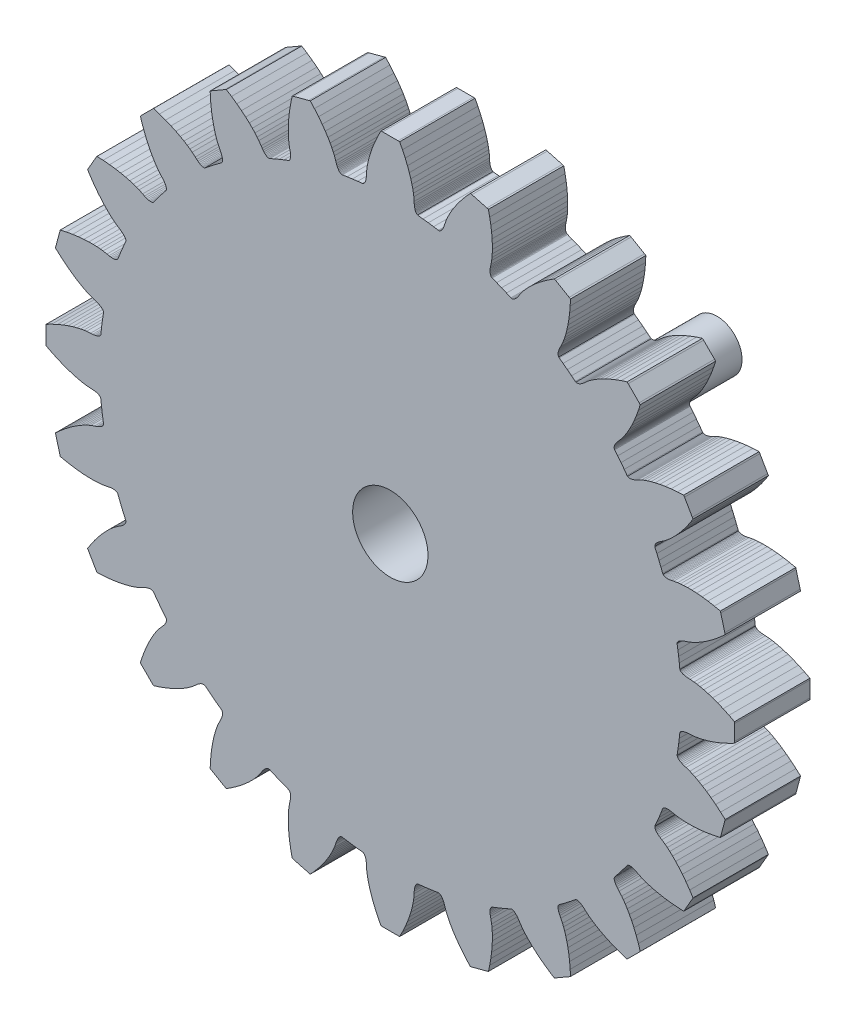
from build123d import *

# Parameters (mm, degrees)
SKETCH2_R           = 1.905
BOSS_EXTRUDE1_DEPTH = 3.81
SKETCH3_R           = 3.81
BOSS_EXTRUDE2_DEPTH = 2.54
SKETCH4_R           = 1.27
BOSS_EXTRUDE3_DEPTH = 10.16


with BuildPart() as part:
    # Sketch2 → Boss-Extrude1 (new body)
    with BuildSketch(Plane.XY):
        Polygon((3.289576242, 23.003571315), (3.038944057, 22.794199304), (2.802065264, 22.611666434), (2.578939862, 22.45437037), (2.372505468, 22.321776998), (2.181960915, 22.210281061), (2.010911459, 22.11908139), (1.861760607, 22.048044458), (1.731437212, 21.992229725), (1.541560299, 21.924130411), (1.439277799, 21.892217202), (1.369843203, 21.866179229), (1.308286764, 21.838672447), (1.25460848, 21.809696856), (1.20827424, 21.779920097), (1.169818157, 21.749475697), (1.138706117, 21.718363657), (1.115472233, 21.687919258), (1.100383561, 21.657474858), (1.092371877, 21.627030458), (1.093039517, 21.59164552), (1.130694433, 21.352630278), (1.168349348, 21.085173557), (1.201063725, 20.817983892), (1.226434058, 20.577366313), (1.235113382, 20.541981375), (1.250335582, 20.515142233), (1.273569466, 20.489638372), (1.304013865, 20.466538016), (1.341668781, 20.444772941), (1.386534212, 20.425277843), (1.439277799, 20.408586835), (1.498831317, 20.394165803), (1.565461823, 20.38401767), (1.638768733, 20.376673626), (1.745858244, 20.372400728), (1.947352099, 20.355843248), (2.087155986, 20.335413453), (2.249926702, 20.304969054), (2.439135974, 20.261572432), (2.651445603, 20.20295361), (2.885386779, 20.127510251), (3.14176067, 20.034040603), (3.417763187, 19.91880588), (3.713394331, 19.78127197), (3.991533297, 19.637862824), (3.993803274, 19.559615376), (3.993803274, 18.774203278), (3.991533297, 18.695421718), (3.713394331, 18.552546685), (3.417763187, 18.415012774), (3.14176067, 18.299778051), (2.885386779, 18.205640763), (2.651445603, 18.130998573), (2.439135974, 18.072246223), (2.249926702, 18.028849601), (2.087155986, 17.998405201), (1.947352099, 17.978108935), (1.745858244, 17.961551454), (1.638768733, 17.957145028), (1.565461823, 17.949800984), (1.498831317, 17.939118739), (1.439277799, 17.92523182), (1.386534212, 17.908540811), (1.341668781, 17.889045713), (1.304013865, 17.867280638), (1.273569466, 17.843379114), (1.250335582, 17.818008781), (1.235113382, 17.791303167), (1.226434058, 17.756452341), (1.201063725, 17.51596829), (1.168349348, 17.247843929), (1.130694433, 16.981321904), (1.093039517, 16.742306662), (1.092371877, 16.705987028), (1.100383561, 16.676343796), (1.115472233, 16.645899397), (1.138706117, 16.615454997), (1.169818157, 16.584342957), (1.20827424, 16.553898558), (1.25460848, 16.524255327), (1.308286764, 16.495279736), (1.369843203, 16.467639426), (1.439277799, 16.441601452), (1.541560299, 16.409688244), (1.731437212, 16.341588929), (1.861760607, 16.285907725), (2.010911459, 16.214203152), (2.181960915, 16.123537593), (2.372505468, 16.012041656), (2.578939862, 15.878780644), (2.802065264, 15.72148458), (3.038944057, 15.539619351), (3.289576242, 15.329579699), (3.520713328, 15.119540048), (3.501752342, 15.043429049), (3.299056735, 14.284188452), (3.276624019, 14.208878621), (2.971512383, 14.142915756), (2.649976794, 14.086433383), (2.353678011, 14.046642018), (2.081147223, 14.021939326), (1.836390274, 14.010455912), (1.615534849, 14.008987103), (1.422052678, 14.015529978), (1.256878457, 14.028482201), (1.116273401, 14.04517321), (0.917850692, 14.081359316), (0.812630574, 14.1045932), (0.740391889, 14.116877782), (0.673093742, 14.123420658), (0.612071415, 14.125557107), (0.557191379, 14.122619489), (0.508587162, 14.116210142), (0.466392293, 14.1045932), (0.431007355, 14.089371), (0.402031764, 14.071211183), (0.38013316, 14.048778467), (0.36290804, 14.017666428), (0.275981267, 13.791603408), (0.175301104, 13.541638864), (0.070348042, 13.293944297), (-0.028329201, 13.072287704), (-0.038343806, 13.038238046), (-0.038343806, 13.006992478), (-0.03113329, 12.973743989), (-0.016712259, 12.937557883), (0.005052816, 12.899902967), (0.033894879, 12.860779243), (0.070882154, 12.820186711), (0.115881113, 12.778125369), (0.168090588, 12.735396387), (0.228178219, 12.692654052), (0.318576721, 12.635423922), (0.48455211, 12.520242611), (0.595513935, 12.432568081), (0.721430903, 12.325358395), (0.863504768, 12.192791729), (1.018530855, 12.035589134), (1.183571548, 11.85375061), (1.358226261, 11.644391952), (1.54009149, 11.406778754), (1.727030786, 11.139468914), (1.896477905, 10.876485384), (1.858822989, 10.807665017), (1.466250468, 10.128140677), (1.425657936, 10.060775767), (1.112801671, 10.075263562), (0.788194937, 10.104239153), (0.491094985, 10.142641826), (0.222436512, 10.189723823), (-0.017379899, 10.241158834), (-0.231024808, 10.296946861), (-0.416495295, 10.354176992), (-0.572990191, 10.409230614), (-0.704114755, 10.461386678), (-0.886781152, 10.547605751), (-0.981586081, 10.597585307), (-1.049151283, 10.628016354), (-1.111909475, 10.651917878), (-1.170795353, 10.669303233), (-1.224340109, 10.680893469), (-1.272944326, 10.686688587), (-1.316340948, 10.686688587), (-1.354797032, 10.681614521), (-1.38737788, 10.671466388), (-1.414083494, 10.655536489), (-1.438786187, 10.629458457), (-1.580860051, 10.433866543), (-1.743096654, 10.218699413), (-1.908938515, 10.006443196), (-2.061828153, 9.818088503), (-2.079854443, 9.787657456), (-2.088533767, 9.757226409), (-2.090002576, 9.723190105), (-2.08559615, 9.684787432), (-2.074112736, 9.642779502), (-2.055952918, 9.597139608), (-2.030716114, 9.548588802), (-1.998802905, 9.496446092), (-1.959011541, 9.442100168), (-1.911876133, 9.384870038), (-1.839370392, 9.305914891), (-1.708913469, 9.151609855), (-1.624256673, 9.038591698), (-1.530787026, 8.90168537), (-1.427970413, 8.737218848), (-1.318610925, 8.545979948), (-1.206180291, 8.327194208), (-1.091746737, 8.07944623), (-0.977313182, 7.80343036), (-0.865683717, 7.496983443), (-0.770878789, 7.198534858), (-0.825224713, 7.142025779), (-1.380167365, 6.587109833), (-1.436516209, 6.532763909), (-1.73508497, 6.627662307), (-2.041531887, 6.739238361), (-2.317400876, 6.853698621), (-2.565228971, 6.968158882), (-2.784081475, 7.080455987), (-2.975293669, 7.189828828), (-3.139800249, 7.292712204), (-3.276666519, 7.386155147), (-3.389764793, 7.470905412), (-3.543989712, 7.601308923), (-3.623038329, 7.673761253), (-3.680188342, 7.720856603), (-3.734534266, 7.760688026), (-3.786610212, 7.792561176), (-3.835214429, 7.817918156), (-3.880881029, 7.836037915), (-3.92294237, 7.847628151), (-3.961264926, 7.851967813), (-3.995314583, 7.85052571), (-4.025625455, 7.84181968), (-4.056069854, 7.823726627), (-4.244477959, 7.670850341), (-4.456921115, 7.504955069), (-4.672034834, 7.34269176), (-4.867386398, 7.200698013), (-4.893557899, 7.176075437), (-4.909581267, 7.149263001), (-4.9197294, 7.116668799), (-4.924803467, 7.078266127), (-4.924803467, 7.034816093), (-4.91906176, 6.986265288), (-4.90731129, 6.932667121), (-4.890086169, 6.873981535), (-4.866184645, 6.810942934), (-4.835740245, 6.743578023), (-4.78566722, 6.648679625), (-4.699408088, 6.466133403), (-4.647332141, 6.334995487), (-4.592185049, 6.178527297), (-4.534901507, 5.993070162), (-4.479353831, 5.779345136), (-4.427678468, 5.539582137), (-4.380676588, 5.270790135), (-4.342220505, 4.973783653), (-4.313378442, 4.649243683), (-4.298823883, 4.336280596), (-4.366122029, 4.295701416), (-5.045646369, 3.903062131), (-5.114413324, 3.865393863), (-5.377463619, 4.034921099), (-5.64492034, 4.221820336), (-5.882466773, 4.403658859), (-6.091838784, 4.578246809), (-6.273570485, 4.743421029), (-6.43086655, 4.898433764), (-6.563459922, 5.040440864), (-6.670682961, 5.166478008), (-6.758410901, 5.277319658), (-6.873512096, 5.44321493), (-6.93066211, 5.533773666), (-6.97352462, 5.593901355), (-7.016120073, 5.646070771), (-7.058181415, 5.690976261), (-7.098907476, 5.727923477), (-7.1380312, 5.756899068), (-7.175686115, 5.778624085), (-7.211738694, 5.79311188), (-7.245120711, 5.800362454), (-7.276366279, 5.800362454), (-7.310282408, 5.790214321), (-7.532072529, 5.691710665), (-7.779900624, 5.586664134), (-8.029598112, 5.485957264), (-8.255661132, 5.399017139), (-8.2869067, 5.381645137), (-8.309339415, 5.359906768), (-8.327499233, 5.33094453), (-8.342721432, 5.295439417), (-8.354204846, 5.253418133), (-8.360747722, 5.204880681), (-8.363685339, 5.149827058), (-8.361415362, 5.088978317), (-8.355006015, 5.021600054), (-8.342721432, 4.949161077), (-8.319487549, 4.844114546), (-8.283167914, 4.645611719), (-8.266610433, 4.505073427), (-8.253524683, 4.339899207), (-8.246981807, 4.146470447), (-8.248450616, 3.925521552), (-8.25993403, 3.68065778), (-8.284636723, 3.408287227), (-8.324561615, 3.11197509), (-8.381043988, 2.790319326), (-8.446873326, 2.485341218), (-8.522183156, 2.462881797), (-9.281423753, 2.260052661), (-9.357534752, 2.241211851), (-9.567574403, 2.472308879), (-9.777747583, 2.722967769), (-9.959479284, 2.959846562), (-10.116775348, 3.182971964), (-10.250169889, 3.389446416), (-10.361532298, 3.579977617), (-10.452331384, 3.750933603), (-10.523902429, 3.900164572), (-10.579717161, 4.030554731), (-10.647682948, 4.220378233), (-10.679596157, 4.322527205), (-10.705767658, 4.392068623), (-10.73327444, 4.453638415), (-10.762383559, 4.507249935), (-10.79202679, 4.553624233), (-10.82247119, 4.592013552), (-10.85358323, 4.623165651), (-10.884027629, 4.646346123), (-10.914472029, 4.66155497), (-10.94411526, 4.669526596), (-10.980301367, 4.668792192), (-11.219316609, 4.631123924), (-11.485972161, 4.593455656), (-11.753962995, 4.560848101), (-11.994580574, 4.535504474), (-12.0294314, 4.526798444), (-12.056137013, 4.511589597), (-12.081507346, 4.488409124), (-12.10540887, 4.457978077), (-12.127173946, 4.420309809), (-12.146535515, 4.375390967), (-12.163226524, 4.322527205), (-12.177246971, 4.263107215), (-12.187929217, 4.196463356), (-12.195139732, 4.123289974), (-12.199679687, 4.016080288), (-12.216103639, 3.814693255), (-12.236533434, 3.674876015), (-12.266977833, 3.511878302), (-12.310374455, 3.322789204), (-12.369126805, 3.110532987), (-12.443635468, 2.8765384), (-12.537906284, 2.620097745), (-12.653007479, 2.344081875), (-12.790674917, 2.048504143), (-12.933416422, 1.770325118), (-13.012331511, 1.76814861), (-13.797743609, 1.76814861), (-13.875991057, 1.770325118), (-14.019266674, 2.048504143), (-14.156934113, 2.344081875), (-14.272035307, 2.620097745), (-14.365504955, 2.8765384), (-14.441081842, 3.110532987), (-14.499700664, 3.322789204), (-14.543097286, 3.511878302), (-14.573541686, 3.674876015), (-14.593837952, 3.814693255), (-14.610528961, 4.016080288), (-14.614801859, 4.123289974), (-14.622012375, 4.196463356), (-14.632160508, 4.263107215), (-14.646715067, 4.322527205), (-14.663406076, 4.375390967), (-14.682901174, 4.420309809), (-14.704666249, 4.457978077), (-14.727766605, 4.488409124), (-14.753270466, 4.511589597), (-14.779976079, 4.526798444), (-14.815494546, 4.535504474), (-15.055978597, 4.560848101), (-15.32330179, 4.593455656), (-15.590624982, 4.631123924), (-15.829640225, 4.668792192), (-15.865158691, 4.669526596), (-15.89560309, 4.66155497), (-15.92604749, 4.646346123), (-15.95649189, 4.623165651), (-15.98760393, 4.592013552), (-16.018048329, 4.553624233), (-16.047825088, 4.507249935), (-16.076800679, 4.453638415), (-16.104307461, 4.392068623), (-16.130345435, 4.322527205), (-16.162258643, 4.220378233), (-16.230357958, 4.030554731), (-16.286039162, 3.900164572), (-16.357076095, 3.750933603), (-16.448409293, 3.579977617), (-16.55990523, 3.389446416), (-16.692498602, 3.182971964), (-16.849661139, 2.959846562), (-17.032327536, 2.722967769), (-17.241566019, 2.472308879), (-17.452406839, 2.241211851), (-17.529185479, 2.260052661), (-18.287758435, 2.462881797), (-18.362400625, 2.485341218), (-18.429031131, 2.790319326), (-18.485513504, 3.11197509), (-18.524637228, 3.408287227), (-18.549206393, 3.68065778), (-18.561490975, 3.925521552), (-18.562959784, 4.146470447), (-18.555749268, 4.339899207), (-18.543464686, 4.505073427), (-18.526106037, 4.645611719), (-18.490587571, 4.844114546), (-18.466686047, 4.949161077), (-18.455069105, 5.021600054), (-18.447858589, 5.088978317), (-18.44638978, 5.149827058), (-18.448526229, 5.204880681), (-18.455736745, 5.253418133), (-18.467353687, 5.295439417), (-18.481908246, 5.33094453), (-18.500735704, 5.359906768), (-18.522500779, 5.381645137), (-18.554280459, 5.399017139), (-18.780343479, 5.485957264), (-19.030308023, 5.586664134), (-19.27800259, 5.691710665), (-19.498991543, 5.790214321), (-19.533708841, 5.800362454), (-19.564954409, 5.800362454), (-19.598202898, 5.79311188), (-19.633721364, 5.778624085), (-19.671376279, 5.756899068), (-19.711167644, 5.727923477), (-19.751813588, 5.690976261), (-19.793808165, 5.646070771), (-19.835842801, 5.593901355), (-19.879306187, 5.533773666), (-19.936536317, 5.44321493), (-20.051730982, 5.277319658), (-20.138644402, 5.166478008), (-20.246588492, 5.040440864), (-20.379168511, 4.898433764), (-20.535636702, 4.743421029), (-20.717475225, 4.578246809), (-20.927554935, 4.403658859), (-21.164460434, 4.221820336), (-21.431783627, 4.034921099), (-21.695461503, 3.865393863), (-21.765002921, 3.903062131), (-22.444527261, 4.295701416), (-22.511184473, 4.336280596), (-22.495975626, 4.649243683), (-22.467707734, 4.973783653), (-22.428597362, 5.270790135), (-22.382236417, 5.539582137), (-22.330067001, 5.779345136), (-22.274278974, 5.993070162), (-22.217796601, 6.178527297), (-22.162729626, 6.334995487), (-22.110560209, 6.466133403), (-22.024367841, 6.648679625), (-21.974388285, 6.743578023), (-21.943943886, 6.810942934), (-21.920042361, 6.873981535), (-21.901922602, 6.932667121), (-21.890332366, 6.986265288), (-21.884550601, 7.034816093), (-21.884550601, 7.078266127), (-21.890332366, 7.116668799), (-21.900480499, 7.149263001), (-21.916423751, 7.176075437), (-21.941780731, 7.200698013), (-22.13810705, 7.34269176), (-22.353247473, 7.504955069), (-22.565517044, 7.670850341), (-22.753871737, 7.823726627), (-22.784289431, 7.84181968), (-22.813999426, 7.85052571), (-22.848770135, 7.851967813), (-22.886438403, 7.847628151), (-22.928459686, 7.836037915), (-22.97409958, 7.817918156), (-23.023358084, 7.792561176), (-23.075527501, 7.760688026), (-23.129846719, 7.720856603), (-23.187076849, 7.673761253), (-23.266045349, 7.601308923), (-23.41961598, 7.470905412), (-23.533355189, 7.386155147), (-23.669553818, 7.292712204), (-23.834006987, 7.189828828), (-24.025980291, 7.080455987), (-24.244031627, 6.968158882), (-24.491792958, 6.853698621), (-24.768529879, 6.739238361), (-25.074963443, 6.627662307), (-25.37270433, 6.532763909), (-25.42993446, 6.587109833), (-25.985584811, 7.142025779), (-26.039182978, 7.198534858), (-25.94428458, 7.496983443), (-25.831987474, 7.80343036), (-25.718274971, 8.07944623), (-25.603080307, 8.327194208), (-25.490783201, 8.545979948), (-25.382131412, 8.737218848), (-25.279261388, 8.90168537), (-25.185805093, 9.038591698), (-25.101041475, 9.151609855), (-24.970637964, 9.305914891), (-24.897477935, 9.384870038), (-24.85111699, 9.442100168), (-24.811258861, 9.496446092), (-24.779399064, 9.548588802), (-24.754028731, 9.597139608), (-24.735922325, 9.642779502), (-24.724332089, 9.684787432), (-24.719979074, 9.723190105), (-24.721447882, 9.757226409), (-24.729406155, 9.787657456), (-24.748246966, 9.818088503), (-24.900375494, 10.006443196), (-25.066257413, 10.218699413), (-25.228534075, 10.433866543), (-25.371262227, 10.629458457), (-25.395898156, 10.655536489), (-25.422683886, 10.671466388), (-25.455291441, 10.681614521), (-25.492959709, 10.686688587), (-25.537157499, 10.686688587), (-25.585681599, 10.680893469), (-25.639306471, 10.669303233), (-25.697978705, 10.651917878), (-25.761003953, 10.628016354), (-25.828368863, 10.597585307), (-25.923267262, 10.547605751), (-26.105840189, 10.461386678), (-26.2369514, 10.409230614), (-26.393432943, 10.354176992), (-26.578890077, 10.296946861), (-26.791867346, 10.241158834), (-27.032391456, 10.189723823), (-27.301156752, 10.142641826), (-27.597455535, 10.104239153), (-27.92272991, 10.075263562), (-28.234958592, 10.060775767), (-28.276245471, 10.128140677), (-28.669605807, 10.807665017), (-28.706553024, 10.876485384), (-28.537052494, 11.139468914), (-28.350139904, 11.406778754), (-28.16830138, 11.644391952), (-27.992992379, 11.85375061), (-27.827831512, 12.035589134), (-27.673513123, 12.192791729), (-27.531519375, 12.325358395), (-27.405468879, 12.432568081), (-27.294640582, 12.520242611), (-27.128731957, 12.635423922), (-27.038173221, 12.692654052), (-26.978045532, 12.735396387), (-26.925902821, 12.778125369), (-26.880983979, 12.820186711), (-26.844036763, 12.860779243), (-26.814326767, 12.899902967), (-26.792588398, 12.937557883), (-26.778113955, 12.973743989), (-26.770863381, 13.006992478), (-26.771584433, 13.038238046), (-26.780998161, 13.072287704), (-26.880262927, 13.293944297), (-26.985296106, 13.541638864), (-27.086002975, 13.791603408), (-27.172929748, 14.017666428), (-27.190328455, 14.048778467), (-27.212040119, 14.071211183), (-27.240308011, 14.089371), (-27.275799772, 14.1045932), (-27.318542106, 14.116210142), (-27.367079559, 14.122619489), (-27.422146534, 14.125557107), (-27.482995275, 14.123420658), (-27.549639134, 14.116877782), (-27.622812516, 14.1045932), (-27.727124643, 14.081359316), (-27.926335168, 14.04517321), (-28.066152408, 14.028482201), (-28.23204768, 14.015529978), (-28.42547644, 14.008987103), (-28.645704283, 14.010455912), (-28.891289106, 14.021939326), (-29.162965314, 14.046642018), (-29.459971797, 14.086433383), (-29.780893156, 14.142915756), (-30.086605669, 14.208878621), (-30.10906509, 14.284188452), (-30.312641983, 15.043429049), (-30.330735036, 15.119540048), (-30.098916957, 15.329579699), (-29.848992471, 15.539619351), (-29.612100325, 15.72148458), (-29.388974923, 15.878780644), (-29.182500471, 16.012041656), (-28.991982623, 16.123537593), (-28.821013284, 16.214203152), (-28.671061263, 16.285907725), (-28.541392156, 16.341588929), (-28.35159536, 16.409688244), (-28.248725336, 16.441601452), (-28.179891617, 16.467639426), (-28.118321824, 16.495279736), (-28.064710305, 16.524255327), (-28.01834936, 16.553898558), (-27.97996004, 16.584342957), (-27.948794589, 16.615454997), (-27.925614116, 16.645899397), (-27.909684218, 16.676343796), (-27.902433644, 16.705987028), (-27.903154695, 16.742306662), (-27.940822963, 16.981321904), (-27.978504584, 17.247843929), (-28.011098786, 17.51596829), (-28.036469119, 17.756452341), (-28.045148443, 17.791303167), (-28.060370643, 17.818008781), (-28.083551115, 17.843379114), (-28.113968809, 17.867280638), (-28.151637077, 17.889045713), (-28.19655592, 17.908540811), (-28.248725336, 17.92523182), (-28.308118621, 17.939118739), (-28.374775832, 17.949800984), (-28.448656913, 17.957145028), (-28.555866599, 17.961551454), (-28.756545933, 17.978108935), (-28.897084225, 17.998405201), (-29.059360886, 18.028849601), (-29.248436631, 18.072246223), (-29.4614139, 18.130998573), (-29.69542184, 18.205640763), (-29.951141443, 18.299778051), (-30.227878365, 18.415012774), (-30.523442744, 18.552546685), (-30.801621769, 18.695421718), (-30.803798277, 18.774203278), (-30.803798277, 19.559615376), (-30.801621769, 19.637862824), (-30.523442744, 19.78127197), (-30.227878365, 19.91880588), (-29.951141443, 20.034040603), (-29.69542184, 20.127510251), (-29.4614139, 20.20295361), (-29.248436631, 20.261572432), (-29.059360886, 20.304969054), (-28.897084225, 20.335413453), (-28.756545933, 20.355843248), (-28.555866599, 20.372400728), (-28.448656913, 20.376673626), (-28.374775832, 20.38401767), (-28.308118621, 20.394165803), (-28.248725336, 20.408586835), (-28.19655592, 20.425277843), (-28.151637077, 20.444772941), (-28.113968809, 20.466538016), (-28.083551115, 20.489638372), (-28.060370643, 20.515142233), (-28.045148443, 20.541981375), (-28.036469119, 20.577366313), (-28.011098786, 20.817983892), (-27.978504584, 21.085173557), (-27.940822963, 21.352630278), (-27.903154695, 21.59164552), (-27.902433644, 21.627030458), (-27.909684218, 21.657474858), (-27.925614116, 21.687919258), (-27.948794589, 21.718363657), (-27.97996004, 21.749475697), (-28.01834936, 21.779920097), (-28.064710305, 21.809696856), (-28.118321824, 21.838672447), (-28.179891617, 21.866179229), (-28.248725336, 21.892217202), (-28.35159536, 21.924130411), (-28.541392156, 21.992229725), (-28.671061263, 22.048044458), (-28.821013284, 22.11908139), (-28.991982623, 22.210281061), (-29.182500471, 22.321776998), (-29.388974923, 22.45437037), (-29.612100325, 22.611666434), (-29.848992471, 22.794199304), (-30.098916957, 23.003571315), (-30.330735036, 23.214412135), (-30.312641983, 23.291190774), (-30.10906509, 24.049630202), (-30.086605669, 24.124272393), (-29.780893156, 24.190769371), (-29.459971797, 24.247385272), (-29.162965314, 24.286508996), (-28.891289106, 24.311211688), (-28.645704283, 24.323362743), (-28.42547644, 24.324965079), (-28.23204768, 24.317621036), (-28.066152408, 24.305469981), (-27.926335168, 24.287977805), (-27.727124643, 24.252592866), (-27.622812516, 24.228691342), (-27.549639134, 24.216940872), (-27.482995275, 24.209730356), (-27.422146534, 24.208261548), (-27.367079559, 24.210531525), (-27.318542106, 24.217742041), (-27.275799772, 24.229358982), (-27.240308011, 24.243913542), (-27.212040119, 24.262607472), (-27.190328455, 24.284239019), (-27.172929748, 24.316152227), (-27.086002975, 24.542215247), (-26.985296106, 24.792313319), (-26.880262927, 25.040007885), (-26.780998161, 25.26086331), (-26.771584433, 25.295714136), (-26.770863381, 25.326692648), (-26.778113955, 25.360074665), (-26.792588398, 25.39572666), (-26.814326767, 25.433381575), (-26.844036763, 25.473306467), (-26.880983979, 25.513631944), (-26.925902821, 25.555826813), (-26.978045532, 25.597621099), (-27.038173221, 25.641284777), (-27.128731957, 25.69843479), (-27.294640582, 25.813535985), (-27.405468879, 25.900596286), (-27.531519375, 26.008486965), (-27.673513123, 26.141080337), (-27.827831512, 26.297575233), (-27.992992379, 26.479306934), (-28.16830138, 26.689480114), (-28.350139904, 26.926225379), (-28.537052494, 27.1936821), (-28.706553024, 27.457400035), (-28.669605807, 27.526968158), (-28.276245471, 28.206492498), (-28.234958592, 28.273123004), (-27.92272991, 28.257900805), (-27.597455535, 28.229726382), (-27.301156752, 28.19046913), (-27.032391456, 28.14413489), (-26.791867346, 28.092058944), (-26.578890077, 28.036244211), (-26.393432943, 27.97962831), (-26.2369514, 27.924614746), (-26.105840189, 27.872538799), (-25.923267262, 27.786279667), (-25.828368863, 27.73634017), (-25.761003953, 27.70589577), (-25.697978705, 27.681994246), (-25.639306471, 27.663834428), (-25.585681599, 27.652351015), (-25.537157499, 27.64647578), (-25.492959709, 27.64647578), (-25.455291441, 27.652351015), (-25.422683886, 27.66236562), (-25.395898156, 27.67825546), (-25.371262227, 27.703759321), (-25.228534075, 27.899912053), (-25.066257413, 28.115292828), (-24.900375494, 28.327468928), (-24.748246966, 28.515877033), (-24.729406155, 28.546187904), (-24.721447882, 28.575964663), (-24.719979074, 28.610815489), (-24.724332089, 28.648470404), (-24.735922325, 28.690398218), (-24.754028731, 28.735931289), (-24.779399064, 28.785336675), (-24.811258861, 28.837412621), (-24.85111699, 28.891758545), (-24.897477935, 28.949042086), (-24.970637964, 29.028090703), (-25.101041475, 29.181647981), (-25.185805093, 29.295280368), (-25.279261388, 29.431478997), (-25.382131412, 29.595985577), (-25.490783201, 29.787865412), (-25.603080307, 30.005916747), (-25.718274971, 30.253744842), (-25.831987474, 30.530415), (-25.94428458, 30.836861917), (-26.039182978, 31.134629509), (-25.985584811, 31.191779522), (-25.42993446, 31.747523343), (-25.37270433, 31.801201626), (-25.074963443, 31.70626317), (-24.768529879, 31.593832536), (-24.491792958, 31.48020015), (-24.244031627, 31.364965427), (-24.025980291, 31.25280185), (-23.834006987, 31.144110002), (-23.669553818, 31.041159861), (-23.533355189, 30.947690213), (-23.41961598, 30.86289989), (-23.266045349, 30.732576495), (-23.187076849, 30.659269586), (-23.129846719, 30.612935346), (-23.075527501, 30.57327751), (-23.023358084, 30.541364301), (-22.97409958, 30.515993968), (-22.928459686, 30.497834151), (-22.886438403, 30.486350737), (-22.848770135, 30.481810783), (-22.813999426, 30.483279592), (-22.784289431, 30.491291276), (-22.753871737, 30.510252261), (-22.565517044, 30.662340731), (-22.353247473, 30.82831612), (-22.13810705, 30.990552723), (-21.941780731, 31.1331607), (-21.916423751, 31.157863393), (-21.900480499, 31.184569007), (-21.890332366, 31.217149855), (-21.884550601, 31.254804771), (-21.884550601, 31.299136089), (-21.890332366, 31.347606778), (-21.901922602, 31.401151533), (-21.920042361, 31.459903884), (-21.943943886, 31.522929132), (-21.974388285, 31.590360806), (-22.024367841, 31.685299263), (-22.110560209, 31.867698604), (-22.162729626, 31.998823167), (-22.217796601, 32.155451592), (-22.274278974, 32.34078855), (-22.330067001, 32.553765819), (-22.382236417, 32.794249871), (-22.428597362, 33.063041872), (-22.467707734, 33.359340656), (-22.495975626, 33.68461503), (-22.511184473, 33.996803654), (-22.444527261, 34.038197355), (-21.765002921, 34.431437517), (-21.695461503, 34.468424791), (-21.431783627, 34.298844145), (-21.164460434, 34.112171905), (-20.927554935, 33.930173148), (-20.717475225, 33.754984322), (-20.535636702, 33.589676574), (-20.379168511, 33.435451655), (-20.246588492, 33.293511318), (-20.138644402, 33.167460822), (-20.051730982, 33.056498997), (-19.936536317, 32.890790664), (-19.879306187, 32.799991577), (-19.835842801, 32.739903947), (-19.793808165, 32.687828), (-19.751813588, 32.642962569), (-19.711167644, 32.605841766), (-19.671376279, 32.576198535), (-19.633721364, 32.55443346), (-19.598202898, 32.540012428), (-19.564954409, 32.532801913), (-19.533708841, 32.533469553), (-19.498991543, 32.542950046), (-19.27800259, 32.642161401), (-19.030308023, 32.74724799), (-18.780343479, 32.847928154), (-18.554280459, 32.934854927), (-18.522500779, 32.952347103), (-18.500735704, 32.973978651), (-18.481908246, 33.002153073), (-18.467353687, 33.037805067), (-18.455736745, 33.080400521), (-18.448526229, 33.129004738), (-18.44638978, 33.18415183), (-18.447858589, 33.244907101), (-18.455069105, 33.311537607), (-18.466686047, 33.384710989), (-18.490587571, 33.48899641), (-18.526106037, 33.688220288), (-18.543464686, 33.828024176), (-18.555749268, 33.993999565), (-18.562959784, 34.187481736), (-18.561490975, 34.407535992), (-18.549206393, 34.653361166), (-18.524637228, 34.924823729), (-18.485513504, 35.221923681), (-18.429031131, 35.542791629), (-18.362400625, 35.848570906), (-18.287758435, 35.871003621), (-17.529185479, 36.074633926), (-17.452406839, 36.092660215), (-17.241566019, 35.860855488), (-17.032327536, 35.611024472), (-16.849661139, 35.374012151), (-16.692498602, 35.150886749), (-16.55990523, 34.944452355), (-16.448409293, 34.75404133), (-16.357076095, 34.582991874), (-16.286039162, 34.433039853), (-16.230357958, 34.303384099), (-16.162258643, 34.113373658), (-16.130345435, 34.010690573), (-16.104307461, 33.941923618), (-16.076800679, 33.880367178), (-16.047825088, 33.826688895), (-16.018048329, 33.780354655), (-15.98760393, 33.741765044), (-15.95649189, 33.710786532), (-15.92604749, 33.687686176), (-15.89560309, 33.671662808), (-15.865158691, 33.664452292), (-15.829640225, 33.664986404), (-15.590624982, 33.702774848), (-15.32330179, 33.740429763), (-15.055978597, 33.772877083), (-14.815494546, 33.798380945), (-14.779976079, 33.807060269), (-14.753270466, 33.822282469), (-14.727766605, 33.845516353), (-14.704666249, 33.875827224), (-14.682901174, 33.913482139), (-14.663406076, 33.95834757), (-14.646715067, 34.010690573), (-14.632160508, 34.069977036), (-14.622012375, 34.136607542), (-14.614801859, 34.210582092), (-14.610528961, 34.31780513), (-14.593837952, 34.518497817), (-14.573541686, 34.659102873), (-14.543097286, 34.821339476), (-14.499700664, 35.010281693), (-14.441081842, 35.22339249), (-14.365504955, 35.457200138), (-14.272035307, 35.713039917), (-14.156934113, 35.989843602), (-14.019266674, 36.285341217), (-13.875991057, 36.563480184), (-13.797743609, 36.565750161), (-13.012331511, 36.565750161), (-12.933416422, 36.563480184), (-12.790674917, 36.285341217), (-12.653007479, 35.989843602), (-12.537906284, 35.713039917), (-12.443635468, 35.457200138), (-12.369126805, 35.22339249), (-12.310374455, 35.010281693), (-12.266977833, 34.821339476), (-12.236533434, 34.659102873), (-12.216103639, 34.518497817), (-12.199679687, 34.31780513), (-12.195139732, 34.210582092), (-12.187929217, 34.136607542), (-12.177246971, 34.069977036), (-12.163226524, 34.010690573), (-12.146535515, 33.95834757), (-12.127173946, 33.913482139), (-12.10540887, 33.875827224), (-12.081507346, 33.845516353), (-12.056137013, 33.822282469), (-12.0294314, 33.807060269), (-11.994580574, 33.798380945), (-11.753962995, 33.772877083), (-11.485972161, 33.740429763), (-11.219316609, 33.702774848), (-10.980301367, 33.664986404), (-10.94411526, 33.664452292), (-10.914472029, 33.671662808), (-10.884027629, 33.687686176), (-10.85358323, 33.710786532), (-10.82247119, 33.741765044), (-10.79202679, 33.780354655), (-10.762383559, 33.826688895), (-10.73327444, 33.880367178), (-10.705767658, 33.941923618), (-10.679596157, 34.010690573), (-10.647682948, 34.113373658), (-10.579717161, 34.303384099), (-10.523902429, 34.433039853), (-10.452331384, 34.582991874), (-10.361532298, 34.75404133), (-10.250169889, 34.944452355), (-10.116775348, 35.150886749), (-9.959479284, 35.374012151), (-9.777747583, 35.611024472), (-9.567574403, 35.860855488), (-9.357534752, 36.092660215), (-9.281423753, 36.074633926), (-8.522183156, 35.871003621), (-8.446873326, 35.848570906), (-8.381043988, 35.542791629), (-8.324561615, 35.221923681), (-8.284636723, 34.924823729), (-8.25993403, 34.653361166), (-8.248450616, 34.407535992), (-8.246981807, 34.187481736), (-8.253524683, 33.993999565), (-8.266610433, 33.828024176), (-8.283167914, 33.688220288), (-8.319487549, 33.48899641), (-8.342721432, 33.384710989), (-8.355006015, 33.311537607), (-8.361415362, 33.244907101), (-8.363685339, 33.18415183), (-8.360747722, 33.129004738), (-8.354204846, 33.080400521), (-8.342721432, 33.037805067), (-8.327499233, 33.002153073), (-8.309339415, 32.973978651), (-8.2869067, 32.952347103), (-8.255661132, 32.934854927), (-8.029598112, 32.847928154), (-7.779900624, 32.74724799), (-7.532072529, 32.642161401), (-7.310282408, 32.542950046), (-7.276366279, 32.533469553), (-7.245120711, 32.532801913), (-7.211738694, 32.540012428), (-7.175686115, 32.55443346), (-7.1380312, 32.576198535), (-7.098907476, 32.605841766), (-7.058181415, 32.642962569), (-7.016120073, 32.687828), (-6.97352462, 32.739903947), (-6.93066211, 32.799991577), (-6.873512096, 32.890790664), (-6.758410901, 33.056498997), (-6.670682961, 33.167460822), (-6.563459922, 33.293511318), (-6.43086655, 33.435451655), (-6.273570485, 33.589676574), (-6.091838784, 33.754984322), (-5.882466773, 33.930173148), (-5.64492034, 34.112171905), (-5.377463619, 34.298844145), (-5.114413324, 34.468424791), (-5.045646369, 34.431437517), (-4.366122029, 34.038197355), (-4.298823883, 33.996803654), (-4.313378442, 33.68461503), (-4.342220505, 33.359340656), (-4.380676588, 33.063041872), (-4.427678468, 32.794249871), (-4.479353831, 32.553765819), (-4.534901507, 32.34078855), (-4.592185049, 32.155451592), (-4.647332141, 31.998823167), (-4.699408088, 31.867698604), (-4.78566722, 31.685299263), (-4.835740245, 31.590360806), (-4.866184645, 31.522929132), (-4.890086169, 31.459903884), (-4.90731129, 31.401151533), (-4.91906176, 31.347606778), (-4.924803467, 31.299136089), (-4.924803467, 31.254804771), (-4.9197294, 31.217149855), (-4.909581267, 31.184569007), (-4.893557899, 31.157863393), (-4.867386398, 31.1331607), (-4.672034834, 30.990552723), (-4.456921115, 30.82831612), (-4.244477959, 30.662340731), (-4.056069854, 30.510252261), (-4.025625455, 30.491291276), (-3.995314583, 30.483279592), (-3.961264926, 30.481810783), (-3.92294237, 30.486350737), (-3.880881029, 30.497834151), (-3.835214429, 30.515993968), (-3.786610212, 30.541364301), (-3.734534266, 30.57327751), (-3.680188342, 30.612935346), (-3.623038329, 30.659269586), (-3.543989712, 30.732576495), (-3.389764793, 30.86289989), (-3.276666519, 30.947690213), (-3.139800249, 31.041159861), (-2.975293669, 31.144110002), (-2.784081475, 31.25280185), (-2.565228971, 31.364965427), (-2.317400876, 31.48020015), (-2.041531887, 31.593832536), (-1.73508497, 31.70626317), (-1.436516209, 31.801201626), (-1.380167365, 31.747523343), (-0.825224713, 31.191779522), (-0.770878789, 31.134629509), (-0.865683717, 30.836861917), (-0.977313182, 30.530415), (-1.091746737, 30.253744842), (-1.206180291, 30.005916747), (-1.318610925, 29.787865412), (-1.427970413, 29.595985577), (-1.530787026, 29.431478997), (-1.624256673, 29.295280368), (-1.708913469, 29.181647981), (-1.839370392, 29.028090703), (-1.911876133, 28.949042086), (-1.959011541, 28.891758545), (-1.998802905, 28.837412621), (-2.030716114, 28.785336675), (-2.055952918, 28.735931289), (-2.074112736, 28.690398218), (-2.08559615, 28.648470404), (-2.090002576, 28.610815489), (-2.088533767, 28.575964663), (-2.079854443, 28.546187904), (-2.061828153, 28.515877033), (-1.908938515, 28.327468928), (-1.743096654, 28.115292828), (-1.580860051, 27.899912053), (-1.438786187, 27.703759321), (-1.414083494, 27.67825546), (-1.38737788, 27.66236562), (-1.354797032, 27.652351015), (-1.316340948, 27.64647578), (-1.272944326, 27.64647578), (-1.224340109, 27.652351015), (-1.170795353, 27.663834428), (-1.111909475, 27.681994246), (-1.049151283, 27.70589577), (-0.981586081, 27.73634017), (-0.886781152, 27.786279667), (-0.704114755, 27.872538799), (-0.572990191, 27.924614746), (-0.416495295, 27.97962831), (-0.231024808, 28.036244211), (-0.017379899, 28.092058944), (0.222436512, 28.14413489), (0.491094985, 28.19046913), (0.788194937, 28.229726382), (1.112801671, 28.257900805), (1.425657936, 28.273123004), (1.466250468, 28.206492498), (1.858822989, 27.526968158), (1.896477905, 27.457400035), (1.727030786, 27.1936821), (1.54009149, 26.926225379), (1.358226261, 26.689480114), (1.183571548, 26.479306934), (1.018530855, 26.297575233), (0.863504768, 26.141080337), (0.721430903, 26.008486965), (0.595513935, 25.900596286), (0.48455211, 25.813535985), (0.318576721, 25.69843479), (0.228178219, 25.641284777), (0.168090588, 25.597621099), (0.115881113, 25.555826813), (0.070882154, 25.513631944), (0.033894879, 25.473306467), (0.005052816, 25.433381575), (-0.016712259, 25.39572666), (-0.03113329, 25.360074665), (-0.038343806, 25.326692648), (-0.038343806, 25.295714136), (-0.028329201, 25.26086331), (0.070348042, 25.040007885), (0.175301104, 24.792313319), (0.275981267, 24.542215247), (0.36290804, 24.316152227), (0.38013316, 24.284239019), (0.402031764, 24.262607472), (0.431007355, 24.243913542), (0.466392293, 24.229358982), (0.508587162, 24.217742041), (0.557191379, 24.210531525), (0.612071415, 24.208261548), (0.673093742, 24.209730356), (0.740391889, 24.216940872), (0.812630574, 24.228691342), (0.917850692, 24.252592866), (1.116273401, 24.287977805), (1.256878457, 24.305469981), (1.422052678, 24.317621036), (1.615534849, 24.324965079), (1.836390274, 24.323362743), (2.081147223, 24.311211688), (2.353678011, 24.286508996), (2.649976794, 24.247385272), (2.971512383, 24.190769371), (3.276624019, 24.124272393), (3.299056735, 24.049630202), (3.501752342, 23.291190774), (3.520713328, 23.214412135), align=None)
        with Locations((-13.40503756, 19.167042855)):
            Circle(SKETCH2_R, mode=Mode.SUBTRACT)
    extrude(amount=BOSS_EXTRUDE1_DEPTH)

    # Sketch3 → Boss-Extrude2 (add)
    with BuildSketch(Plane(origin=(0, 0, 0), x_dir=(-1, 0, 0), z_dir=(0, 0, -1))):
        with Locations((13.40503756, 19.167042855)):
            Circle(SKETCH3_R)
    extrude(amount=BOSS_EXTRUDE2_DEPTH)

    # Sketch4 → Boss-Extrude3 (add)
    with BuildSketch(Plane(origin=(0, 0, -2.54), x_dir=(-1, 0, 0), z_dir=(0, 0, -1))):
        with Locations((13.40503756, 19.167042855)):
            Circle(SKETCH4_R)
    extrude(amount=BOSS_EXTRUDE3_DEPTH)


solid = part.part
